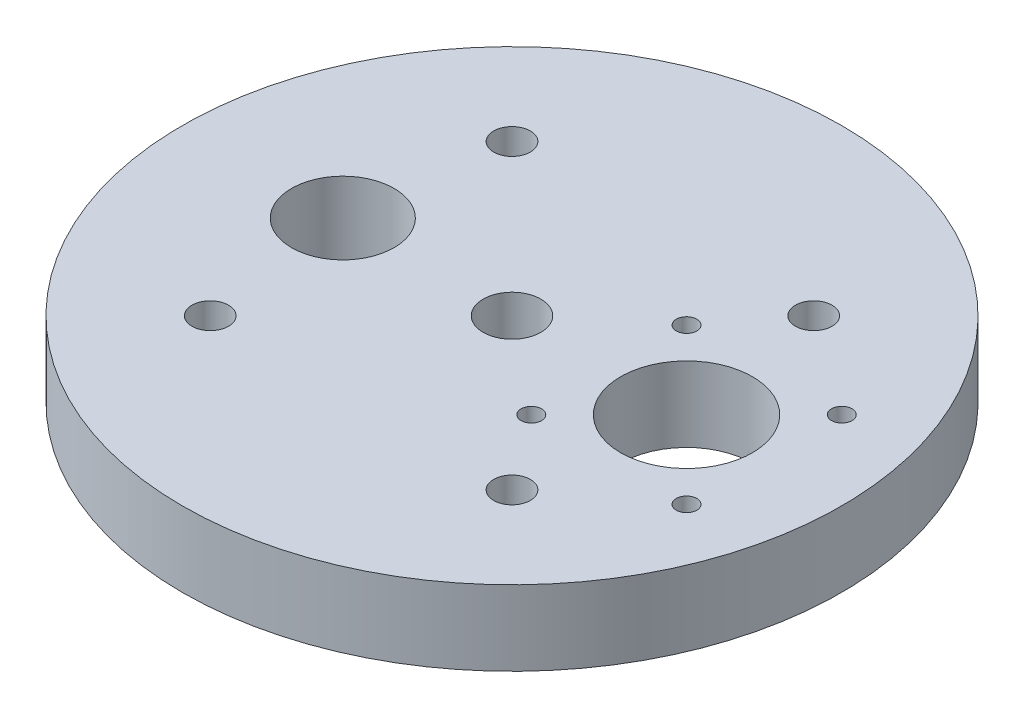
from build123d import *

# Parameters (mm, degrees)
SKETCH2_R           = 57.15
BOSS_EXTRUDE1_DEPTH = 13
CUT_EXTRUDE1_REACH  = 83.861
SKETCH6_R           = 3.175
SKETCH7_R           = 11.43
SKETCH7_R_2         = 1.778
CUT_EXTRUDE2_DEPTH  = 82.861132413
SKETCH8_R           = 5
SKETCH8_R_2         = 8.9
CUT_EXTRUDE3_DEPTH  = 82.861132413


with BuildPart() as part:
    # Sketch2 → Boss-Extrude1 (new body)
    with BuildSketch(Plane(origin=(0, 0, 0), x_dir=(1, 0, 0), z_dir=(0, 1, 0))):
        Circle(SKETCH2_R)
    extrude(amount=BOSS_EXTRUDE1_DEPTH)

    # Sketch6 → Cut-Extrude1 (cut, up to next)
    with BuildSketch(Plane(origin=(0, 13, 0), x_dir=(1, 0, 0), z_dir=(0, 1, 0)), mode=Mode.PRIVATE) as cut_extrude1_sk1:
        with Locations((-26.1629, -26.1629)):
            Circle(SKETCH6_R)
    cut_extrude1_tool1 = extrude(cut_extrude1_sk1.sketch, amount=-CUT_EXTRUDE1_REACH, mode=Mode.PRIVATE) & part.part
    # Sketch6 → Cut-Extrude1 (cut, up to next)
    with BuildSketch(Plane(origin=(0, 13, 0), x_dir=(1, 0, 0), z_dir=(0, 1, 0)), mode=Mode.PRIVATE) as cut_extrude1_sk2:
        with Locations((26.1629, -26.1629)):
            Circle(SKETCH6_R)
    cut_extrude1_tool2 = extrude(cut_extrude1_sk2.sketch, amount=-CUT_EXTRUDE1_REACH, mode=Mode.PRIVATE) & part.part
    # Sketch6 → Cut-Extrude1 (cut, up to next)
    with BuildSketch(Plane(origin=(0, 13, 0), x_dir=(1, 0, 0), z_dir=(0, 1, 0)), mode=Mode.PRIVATE) as cut_extrude1_sk3:
        with Locations((-26.1629, 26.163103615)):
            Circle(SKETCH6_R)
    cut_extrude1_tool3 = extrude(cut_extrude1_sk3.sketch, amount=-CUT_EXTRUDE1_REACH, mode=Mode.PRIVATE) & part.part
    # Sketch6 → Cut-Extrude1 (cut, up to next)
    with BuildSketch(Plane(origin=(0, 13, 0), x_dir=(1, 0, 0), z_dir=(0, 1, 0)), mode=Mode.PRIVATE) as cut_extrude1_sk4:
        with Locations((26.1629, 26.163103615)):
            Circle(SKETCH6_R)
    cut_extrude1_tool4 = extrude(cut_extrude1_sk4.sketch, amount=-CUT_EXTRUDE1_REACH, mode=Mode.PRIVATE) & part.part
    add(cut_extrude1_tool1.solids().sort_by_distance((-26.1629, 13, 26.1629))[0], mode=Mode.SUBTRACT)
    add(cut_extrude1_tool2.solids().sort_by_distance((26.1629, 13, 26.1629))[0], mode=Mode.SUBTRACT)
    add(cut_extrude1_tool3.solids().sort_by_distance((-26.1629, 13, -26.163104))[0], mode=Mode.SUBTRACT)
    add(cut_extrude1_tool4.solids().sort_by_distance((26.1629, 13, -26.163104))[0], mode=Mode.SUBTRACT)

    # Sketch7 → Cut-Extrude2 (cut, through all)
    with BuildSketch(Plane(origin=(0, 13, 0), x_dir=(1, 0, 0), z_dir=(0, 1, 0))):
        with Locations((30, 0.269903496)):
            Circle(SKETCH7_R)
        with Locations((16.54, -13.194096504)):
            Circle(SKETCH7_R_2)
        with Locations((16.54, 13.729903496)):
            Circle(SKETCH7_R_2)
        with Locations((43.46, 13.729903496)):
            Circle(SKETCH7_R_2)
        with Locations((43.46, -13.194096504)):
            Circle(SKETCH7_R_2)
    extrude(amount=-CUT_EXTRUDE2_DEPTH, mode=Mode.SUBTRACT)

    # Sketch8 → Cut-Extrude3 (cut, through all)
    with BuildSketch(Plane(origin=(0, 13, 0), x_dir=(1, 0, 0), z_dir=(0, 1, 0))):
        Circle(SKETCH8_R)
        with Locations((-29.3379, 0)):
            Circle(SKETCH8_R_2)
    extrude(amount=-CUT_EXTRUDE3_DEPTH, mode=Mode.SUBTRACT)


solid = part.part
